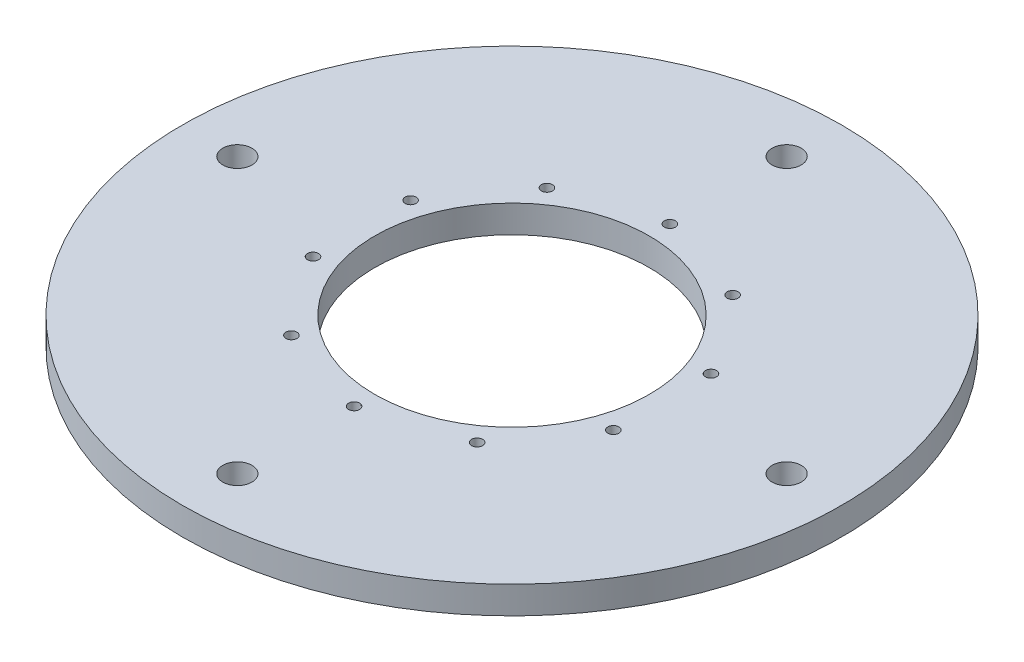
from build123d import *

# Parameters (mm, degrees)
SKETCH1_R                           = 152.4
SKETCH1_R_2                         = 63.5
THRUSTPLATE_TC3_DEPTH               = 12.7
UNDEF_CLEARANCE_THRUSTPLATE_D       = 13.49248
CLEARANCE_THRUSTPLATE_PATTERN_COUNT = 4
F_10_CLEARANCE_HOLE1_D              = 5.1054
CIRPATTERN1_COUNT                   = 10


with BuildPart() as part:
    # Sketch1 → ThrustPlate_TC3 (new body)
    with BuildSketch(Plane(origin=(0, 0, 0), x_dir=(1, 0, 0), z_dir=(0, 1, 0))):
        Circle(SKETCH1_R)
        Circle(SKETCH1_R_2, mode=Mode.SUBTRACT)
    extrude(amount=-THRUSTPLATE_TC3_DEPTH)

    # UNDEF_Clearance_ThrustPlate (through all)
    with Locations(Plane(origin=(0, 0, 0), x_dir=(1, 0, 0), z_dir=(0, 1, 0))):
        with Locations((0, 127)):
            undef_clearance_thrustplate = Hole(UNDEF_CLEARANCE_THRUSTPLATE_D / 2)

    # Clearance_ThrustPlate_Pattern: UNDEF_Clearance_ThrustPlate ×4 about axis
    clearance_thrustplate_pattern_axis = Axis((0, -12.7, 0), (0, 1, 0))
    for i in range(1, CLEARANCE_THRUSTPLATE_PATTERN_COUNT):
        add(undef_clearance_thrustplate.rotate(clearance_thrustplate_pattern_axis, i * 360 / CLEARANCE_THRUSTPLATE_PATTERN_COUNT), mode=Mode.SUBTRACT)

    # #10 Clearance Hole1 (through all)
    with Locations(Plane(origin=(0, 0, 0), x_dir=(1, 0, 0), z_dir=(0, 1, 0))):
        with Locations((0, 73.025)):
            f_10_clearance_hole1 = Hole(F_10_CLEARANCE_HOLE1_D / 2)

    # CirPattern1: #10 Clearance Hole1 ×10 about axis
    cirpattern1_axis = Axis((0, -12.7, 0), (0, 1, 0))
    for i in range(1, CIRPATTERN1_COUNT):
        add(f_10_clearance_hole1.rotate(cirpattern1_axis, i * 360 / CIRPATTERN1_COUNT), mode=Mode.SUBTRACT)


solid = part.part
